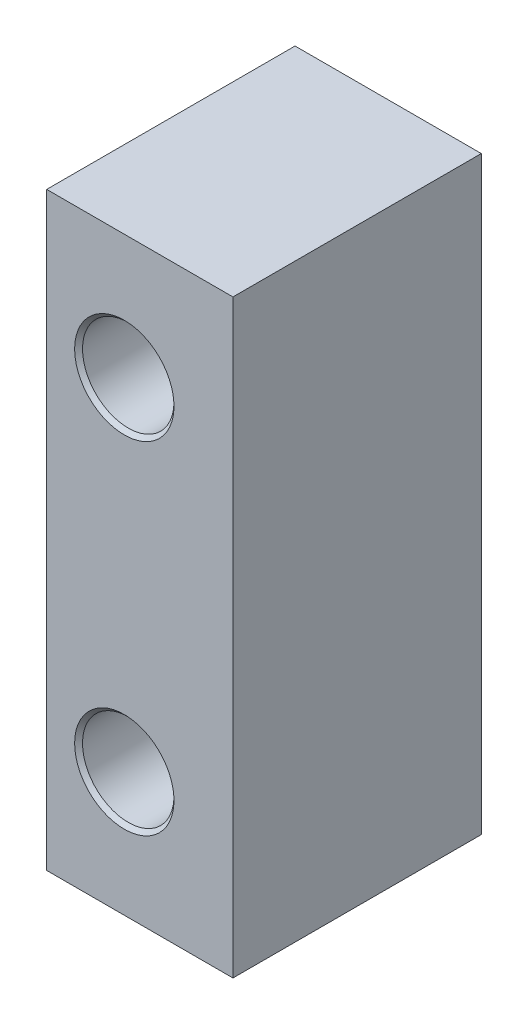
from build123d import *

# Parameters (mm, degrees)
SKETCH_1_W                = 6
SKETCH_1_H                = 19
EXTRUDE_1_DEPTH           = 8
HOLE_WIZARD_41_AT_2_COUNT = 2
HOLE_WIZARD_41_AT_2_PITCH = 11
CHAMFER_1_SIZE            = 0.449397949


with BuildPart() as part:
    # Эскиз1 → Бобышка-Вытянуть1 (new body)
    with BuildSketch(Plane.XY):
        Rectangle(SKETCH_1_W, SKETCH_1_H)
    extrude(amount=EXTRUDE_1_DEPTH)

    # Эскиз2 → Цековка для  винта с внутренним шестигранником #41 (revolve, cut)
    with BuildSketch(Plane(origin=(-0.5, 5.5, 0), x_dir=(0, 1, 0), z_dir=(1, 0, 0))):
        Polygon((0, 0), (0, 8), (1.6002, 8), (1.4732, 7.873), (1.4732, 2.9718), (1.6002, 2.8448), (2.77876, 2.8448), (2.77876, 0.127), (2.90576, 0), align=None)
    hole_wizard_41 = revolve(axis=Axis((-0.5, 5.5, -6.35), (0, 0, 1)), mode=Mode.SUBTRACT)

    # Цековка для  винта с внутренним шестигранником #41 at 2: Цековка для  винта с внутренним шестигранником #41 ×2
    with Locations(*[(0, -i * HOLE_WIZARD_41_AT_2_PITCH, 0) for i in range(1, HOLE_WIZARD_41_AT_2_COUNT)]):
        add(hole_wizard_41, mode=Mode.SUBTRACT)

    # Фаска1
    # the kernel refuses this chamfer: 0.5, 0.449397949 mm, written as the material it takes off along each edge
    with BuildSketch(Plane(origin=(-3, -4.286943061, 2.8448), x_dir=(0.5198491944846588, 0.8542580494169495, 0), z_dir=(0, 0, -1)), Plane(origin=(-3, 6.713056939, 2.8448), x_dir=(0.5198491944846584, 0.8542580494169496, 0), z_dir=(0, 0, -1))) as chamfer_1_piece_1:
        with BuildLine():
            Line((0.526718663, 0), (CHAMFER_1_SIZE * 0.854258048776, -CHAMFER_1_SIZE * 0.519849194094))
            Line((CHAMFER_1_SIZE * 0.854258048776, -CHAMFER_1_SIZE * 0.519849194094), (0, 0))
            ThreePointArc((0, 0), (0.268614935, -0.012503234), (0.526718663, 0))
        make_face()
    extrude(amount=4.061353185, mode=Mode.SUBTRACT)
    with BuildSketch(Plane(origin=(-3, -6.713056939, 2.8448), x_dir=(0.519849194484659, -0.8542580494169493, 0), z_dir=(0, 0, -1)), Plane(origin=(-3, 4.286943061, 2.8448), x_dir=(0.519849194484659, -0.8542580494169493, 0), z_dir=(0, 0, -1))) as chamfer_1_piece_2:
        with BuildLine():
            Line((0.526718663, 0), (CHAMFER_1_SIZE * 0.854258048776, CHAMFER_1_SIZE * 0.519849194094))
            Line((CHAMFER_1_SIZE * 0.854258048776, CHAMFER_1_SIZE * 0.519849194094), (0, 0))
            ThreePointArc((0, 0), (0.268614935, 0.012503234), (0.526718663, 0))
        make_face()
    extrude(amount=4.061353185, mode=Mode.SUBTRACT)


solid = part.part
